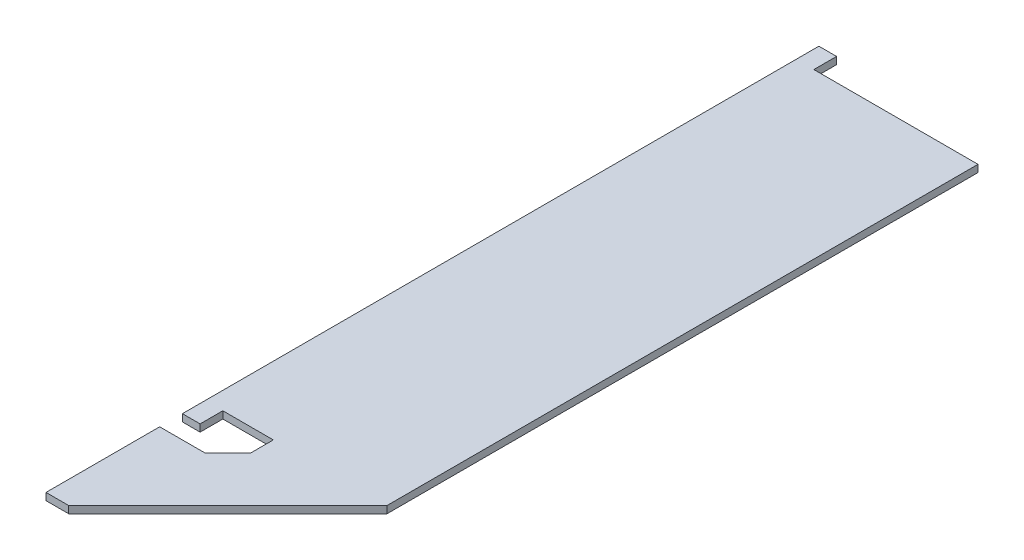
from build123d import *

# Parameters (mm, degrees)
BOSS_EXTRUDE1_DEPTH = 1.00076
SKETCH2_W           = 2.472118206
SKETCH2_H           = 1.00076
BOSS_EXTRUDE2_DEPTH = 3.175
CHAMFER2_SIZE       = 22.225
CHAMFER3_SIZE       = 3.175


with BuildPart() as part:
    # Sketch1 → Boss-Extrude1 (new body)
    with BuildSketch(Plane(origin=(0, 0, 0), x_dir=(1, 0, 0), z_dir=(0, 1, 0))):
        Polygon((-3.175, -41.275), (-3.175, -47.625), (-12.7, -47.625), (-12.7, -63.5), (12.7, -63.5), (12.7, -41.275), (12.7, 41.275), (-12.7, 41.275), (-12.7, -41.275), align=None)
    extrude(amount=BOSS_EXTRUDE1_DEPTH)

    # Sketch2 → Boss-Extrude2 (add)
    with BuildSketch(Plane.XY.offset(41.275)):
        with Locations((-11.463940897, 0.50038)):
            Rectangle(SKETCH2_W, SKETCH2_H)
    boss_extrude2 = extrude(amount=BOSS_EXTRUDE2_DEPTH)

    # Mirror1: Boss-Extrude2 across plane
    add(boss_extrude2.mirror(Plane.XY))

    # Chamfer2
    chamfer2_edges = [part.edges().sort_by_distance(p)[0] for p in [
        (12.7, 0.50038, 63.5),
    ]]
    chamfer(chamfer2_edges, length=CHAMFER2_SIZE)

    # Chamfer3
    chamfer3_edges = [part.edges().sort_by_distance(p)[0] for p in [
        (-3.175, 0.50038, 47.625),
    ]]
    chamfer(chamfer3_edges, length=CHAMFER3_SIZE)


solid = part.part
